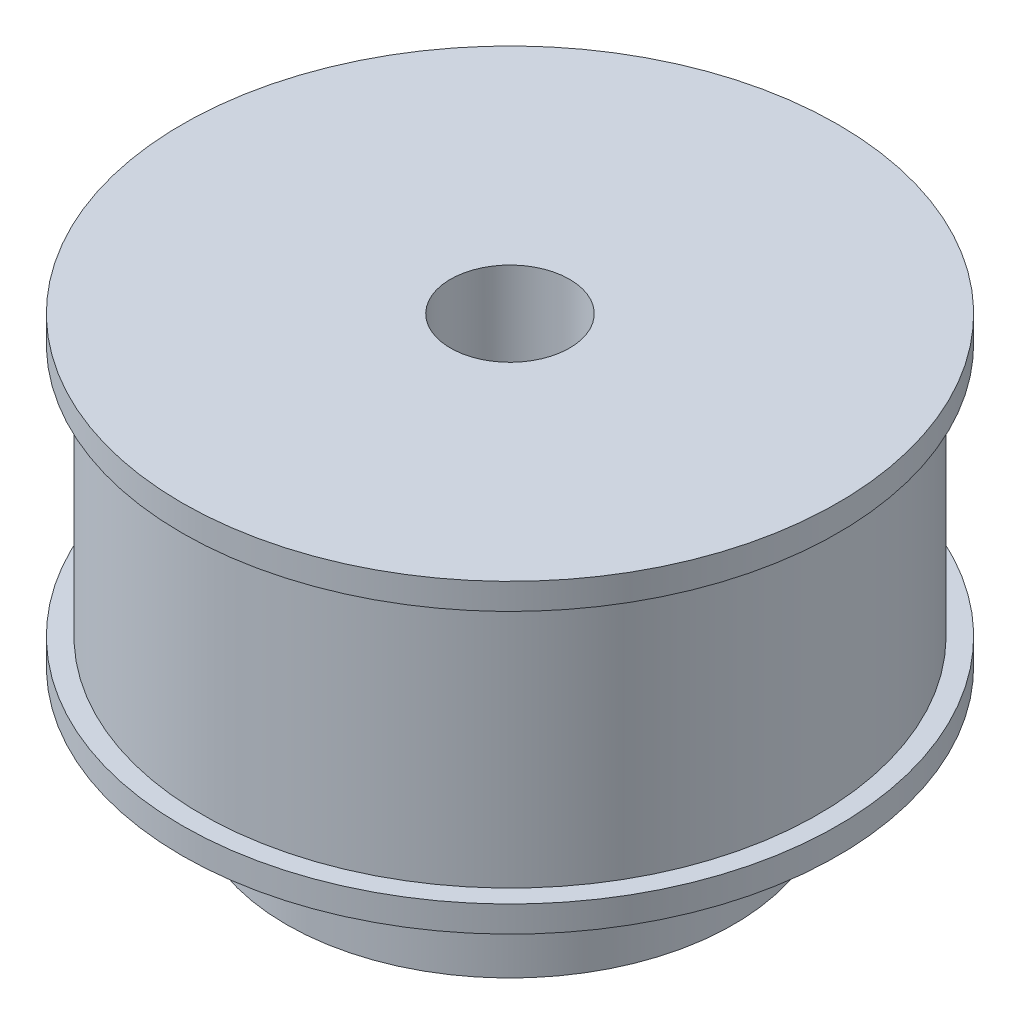
from build123d import *

# Parameters (mm, degrees)
SKETCH5_R          = 2
CUT_EXTRUDE4_DEPTH = 18
SKETCH6_R          = 2
CUT_EXTRUDE5_DEPTH = 18


with BuildPart() as part:
    # Sketch1 → Revolve1 (revolve)
    with BuildSketch(Plane.XY):
        Polygon((4, 0), (15, 0), (15, 7.5), (22, 7.5), (22, 9.25), (20.69, 9.25), (20.69, 26.25), (22, 26.25), (22, 28), (4, 28), align=None)
    revolve(axis=Axis((0, 0, 0), (0, 1, 0)))

    # Sketch5 → Cut-Extrude4 (cut)
    with BuildSketch(Plane.XY):
        with Locations((0, 3.526654559)):
            Circle(SKETCH5_R)
    extrude(amount=-CUT_EXTRUDE4_DEPTH, mode=Mode.SUBTRACT)

    # Sketch6 → Cut-Extrude5 (cut)
    with BuildSketch(Plane(origin=(0, 0, 0), x_dir=(0, 0, -1), z_dir=(1, 0, 0))):
        with Locations((0, 3.75)):
            Circle(SKETCH6_R)
    extrude(amount=-CUT_EXTRUDE5_DEPTH, mode=Mode.SUBTRACT)


solid = part.part
